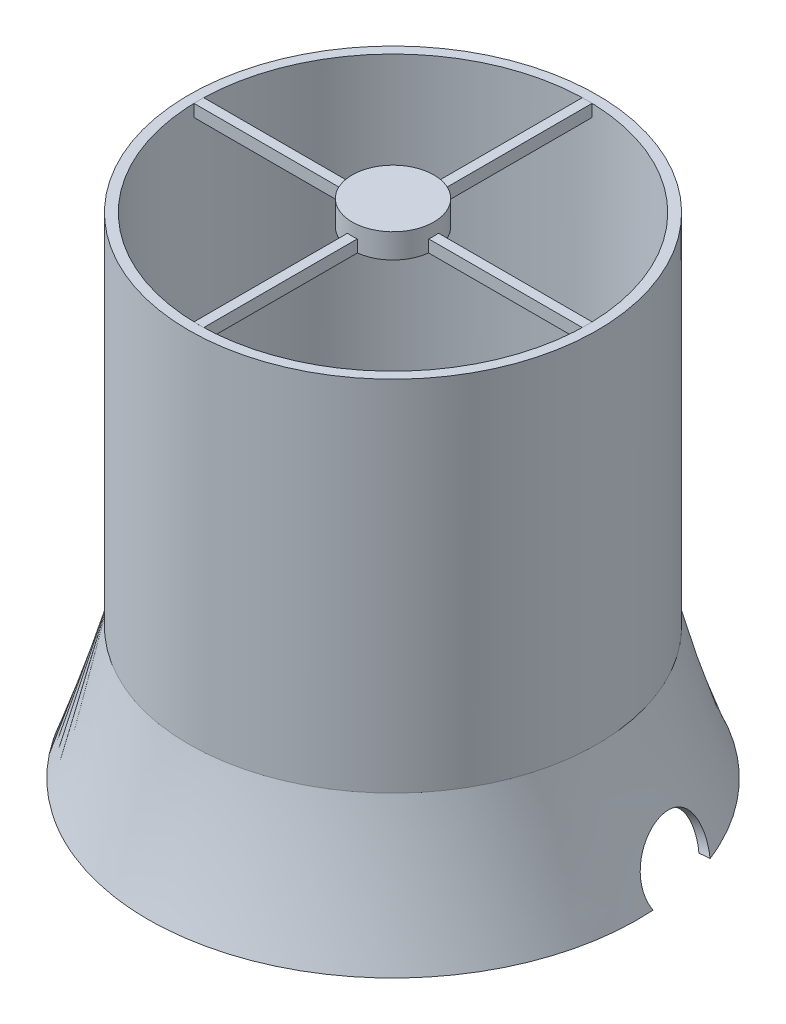
from build123d import *

# Parameters (mm, degrees)
SKETCH1_R                  = 25
BOSS_EXTRUDE1_DEPTH        = 60
SKETCH3_R                  = 23.8
CUT_EXTRUDE1_DEPTH         = 43.5
SKETCH4_R                  = 28.8
CUT_EXTRUDE2_DEPTH         = 18
CUT_EXTRUDE2_DRAFT         = -15.5
BOSS_EXTRUDE2_DEPTH        = 1.5
SKETCH7_R                  = 5
BOSS_EXTRUDE3_DEPTH        = 1.5
F_10_0MM_START             = -28.308378884
F_10_0MM_DOWEL_HOLE2_DEPTH = 57.308378884


with BuildPart() as part:
    # Sketch1 → Boss-Extrude1 (new body)
    with BuildSketch(Plane(origin=(0, 0, 0), x_dir=(1, 0, 0), z_dir=(0, 1, 0))):
        with Locations(Location((0, 0, 0), (0, 0, 270))):
            Circle(SKETCH1_R)
    extrude(amount=BOSS_EXTRUDE1_DEPTH)

    # Loft1: read off the stored shape, not the designer's step
    # Loft1: loft between two sections, ruled curve by curve
    loft1_from = [
        Edge.make_bspline([(8.658923116, 0, -28.723214487), (-48.787505858, 0, -46.04106072), (-66.10535209, 0, 11.405368254), (-8.658923116, 0, 28.723214487), (48.787505858, 0, 46.04106072), (66.10535209, 0, -11.405368254), (8.658923116, 0, -28.723214487)], [0, 0, 0, 0, 0.5, 0.5, 0.5, 1, 1, 1, 1], 3, [1, 0.333333333, 0.333333333, 1, 0.333333333, 0.333333333, 1]),
    ]
    loft1_to = [
        Edge.make_bspline([(24.972981891, 60, -1.161970511), (22.649040869, 60, -51.107934293), (-27.296922913, 60, -48.783993271), (-24.972981891, 60, 1.161970511), (-22.649040869, 60, 51.107934293), (27.296922913, 60, 48.783993271), (24.972981891, 60, -1.161970511)], [0, 0, 0, 0, 0.5, 0.5, 0.5, 1, 1, 1, 1], 3, [1, 0.333333333, 0.333333333, 1, 0.333333333, 0.333333333, 1]),
    ]
    loft1 = Solid(Shell([*[Face.make_surface_from_curves(loft1_from[k], loft1_to[k]) for k in range(1)], Face(Wire(loft1_from)), Face(Wire(loft1_to))]))
    add(loft1)

    # Sketch3 → Cut-Extrude1 (cut)
    with BuildSketch(Plane(origin=(0, 60, 0), x_dir=(1, 0, 0), z_dir=(0, 1, 0))):
        with Locations(Location((0, 0, 0), (0, 0, 270))):
            Circle(SKETCH3_R)
    extrude(amount=-CUT_EXTRUDE1_DEPTH, mode=Mode.SUBTRACT)


with BuildPart() as cut_extrude2_tool:
    # Sketch4 → Cut-Extrude2 (with draft: the straight prism first)
    with BuildSketch(Plane.XZ):
        Circle(SKETCH4_R)
    extrude(amount=-CUT_EXTRUDE2_DEPTH)
    # Cut-Extrude2: the draft: its side faces are tilted about the plane it starts from
    cut_extrude2_sides = [cut_extrude2_tool.faces().sort_by_distance(p)[0] for p in [
        (-28.8, 9, 0),
    ]]
    draft(cut_extrude2_sides, Plane.XZ, CUT_EXTRUDE2_DRAFT)


with BuildPart() as part_1:
    add(part.part)

    # Cut-Extrude2: cut by cut_extrude2_tool
    add(cut_extrude2_tool.part, mode=Mode.SUBTRACT)

    # Ø10.0mm Dowel Hole2: read off the stored shape, not the designer's step
    # Ø10.0mm Dowel Hole2 outline → Ø10.0mm Dowel Hole2 (cut)
    with BuildSketch(Plane(origin=(0, 0, 0), x_dir=(-0.32323309601854383, 0.9436126294827636, 0.07152322083695323), z_dir=(0.9213269803701237, 0.33105166587803897, -0.20386610743682995)).offset(F_10_0MM_START)):
        with BuildLine():
            Line((-11, -4.086571585), (-9.814355471, -4.595129374))
            ThreePointArc((-9.814355471, -4.595129374), (-2.843369415, -4.13e-07), (-9.814354711, 4.5951297))
            Line((-9.814354711, 4.5951297), (-11, 4.086571817))
            Line((-11, 4.086571817), (-11, -4.086571585))
        make_face()
    extrude(amount=F_10_0MM_DOWEL_HOLE2_DEPTH, mode=Mode.SUBTRACT)


with BuildPart() as body_2:
    # Sketch6 → Boss-Extrude2 (new body)
    with BuildSketch(Plane(origin=(0, 60, 0), x_dir=(1, 0, 0), z_dir=(0, 1, 0))):
        with BuildLine():
            Line((-4.963869458, 0.6), (-23.792435773, 0.6))
            Line((-23.792435773, 0.6), (-23.792435773, -0.6))
            Line((-23.792435773, -0.6), (-4.963869458, -0.6))
            ThreePointArc((-4.963869458, -0.6), (-3.535533906, -3.535533906), (-0.6, -4.963869458))
            Line((-0.6, -4.963869458), (-0.6, -23.792435773))
            Line((-0.6, -23.792435773), (0.6, -23.792435773))
            Line((0.6, -23.792435773), (0.6, -4.963869458))
            ThreePointArc((0.6, -4.963869458), (3.535533906, -3.535533906), (4.963869458, -0.6))
            Line((4.963869458, -0.6), (23.792435773, -0.6))
            Line((23.792435773, -0.6), (23.792435773, 0.6))
            Line((23.792435773, 0.6), (4.963869458, 0.6))
            ThreePointArc((4.963869458, 0.6), (3.535533906, 3.535533906), (0.6, 4.963869458))
            Line((0.6, 4.963869458), (0.6, 23.792435773))
            Line((0.6, 23.792435773), (-0.6, 23.792435773))
            Line((-0.6, 23.792435773), (-0.6, 4.963869458))
            ThreePointArc((-0.6, 4.963869458), (-3.535533906, 3.535533906), (-4.963869458, 0.6))
        make_face()
    extrude(amount=-BOSS_EXTRUDE2_DEPTH)

    # Sketch7 → Boss-Extrude3 (add)
    with BuildSketch(Plane(origin=(0, 60, 0), x_dir=(1, 0, 0), z_dir=(0, 1, 0))):
        with Locations(Location((0, 0, 0), (0, 0, 270))):
            Circle(SKETCH7_R)
    extrude(amount=BOSS_EXTRUDE3_DEPTH)


solid = Compound([part_1.part, body_2.part])
